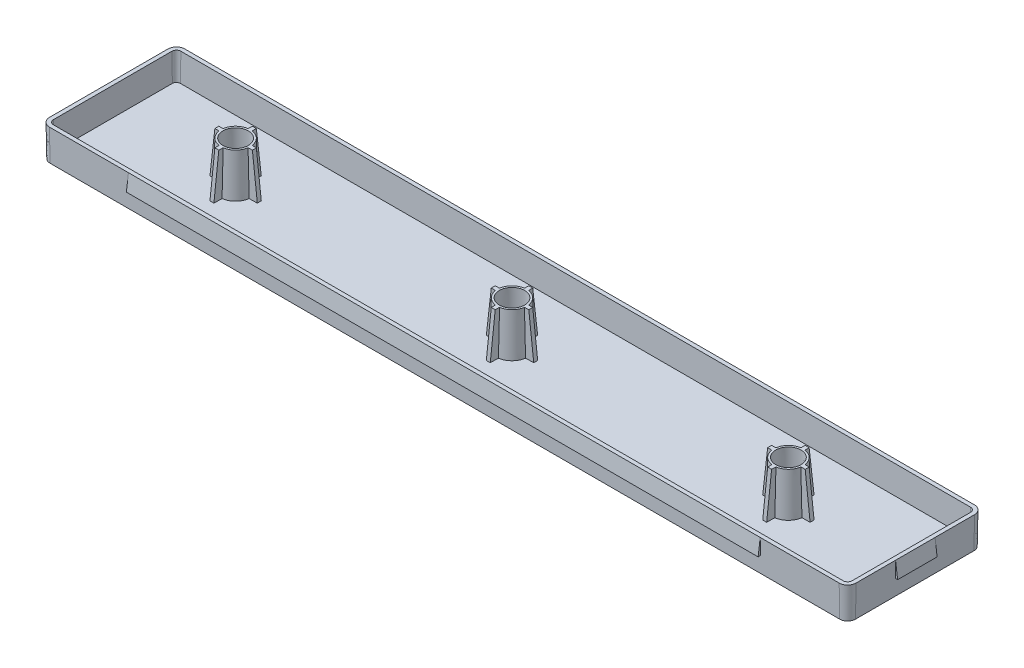
from build123d import *

# Parameters (mm, degrees)
BOSS_EXTRUDE1_DEPTH           = 4
BOSS_EXTRUDE1_DRAFT           = -1
SHELL1_T                      = -0.5
SKETCH2_R                     = 2
BOSS_EXTRUDE2_DEPTH           = 5.5
BOSS_EXTRUDE2_DRAFT           = 1.5
BOSS_EXTRUDE2_PROFILE_2_DEPTH = 5.5
BOSS_EXTRUDE2_PROFILE_2_DRAFT = 1.5
BOSS_EXTRUDE2_PROFILE_3_DEPTH = 5.5
BOSS_EXTRUDE2_PROFILE_3_DRAFT = 1.5
CIRPATTERN1_COUNT             = 4
SKETCH6_R                     = 1.605977431
CUT_EXTRUDE1_DEPTH            = 5.5
CUT_EXTRUDE1_DRAFT            = 1.5
CUT_EXTRUDE1_PROFILE_2_DEPTH  = 5.5
CUT_EXTRUDE1_PROFILE_2_DRAFT  = 1.5
CUT_EXTRUDE1_PROFILE_3_DEPTH  = 5.5
CUT_EXTRUDE1_PROFILE_3_DRAFT  = 1.5
BOSS_EXTRUDE3_DEPTH           = 2.5
BOSS_EXTRUDE4_DEPTH           = 40


with BuildPart() as part:
    # Sketch1 → Boss-Extrude1 (with draft: the straight prism first)
    with BuildSketch(Plane(origin=(0, 0, 0), x_dir=(1, 0, 0), z_dir=(0, 1, 0))):
        with BuildLine():
            Line((-50, -8.5), (50, -8.5))
            ThreePointArc((50, -8.5), (50.707106781, -8.207106781), (51, -7.5))
            Line((51, -7.5), (51, 7.5))
            ThreePointArc((51, 7.5), (50.707106781, 8.207106781), (50, 8.5))
            Line((50, 8.5), (-50, 8.5))
            ThreePointArc((-50, 8.5), (-50.707106781, 8.207106781), (-51, 7.5))
            Line((-51, 7.5), (-51, -7.5))
            ThreePointArc((-51, -7.5), (-50.707106781, -8.207106781), (-50, -8.5))
        make_face()
    extrude(amount=BOSS_EXTRUDE1_DEPTH)
    # Boss-Extrude1: the draft: its side faces are tilted about the plane it starts from
    boss_extrude1_sides = [part.faces().sort_by_distance(p)[0] for p in [
        (0, 2, 8.5),
        (50.707106781, 2, 8.207106781),
        (51, 2, 0),
        (50.707106781, 2, -8.207106781),
        (0, 2, -8.5),
        (-50.707106781, 2, -8.207106781),
        (-51, 2, 0),
        (-50.707106781, 2, 8.207106781),
    ]]
    draft(boss_extrude1_sides, Plane(origin=(0, 0, 0), x_dir=(1, 0, 0), z_dir=(0, 1, 0)), BOSS_EXTRUDE1_DRAFT)

    # Shell1
    shell1_openings = [part.faces().sort_by_distance(p)[0] for p in [
        (0, 4, 0),
    ]]
    offset(amount=SHELL1_T, openings=shell1_openings, kind=Kind.INTERSECTION)


with BuildPart() as boss_extrude2_tool:
    # Sketch2 → Boss-Extrude2 (with draft: the straight prism first)
    with BuildSketch(Plane(origin=(0, 0.5, 0), x_dir=(1, 0, 0), z_dir=(0, 1, 0))):
        with Locations((35, 0)):
            Circle(SKETCH2_R)
    extrude(amount=BOSS_EXTRUDE2_DEPTH)
    # Boss-Extrude2: the draft: its side faces are tilted about the plane it starts from
    boss_extrude2_sides = [boss_extrude2_tool.faces().sort_by_distance(p)[0] for p in [
        (33, 3.25, 0),
    ]]
    draft(boss_extrude2_sides, Plane(origin=(0, 0.5, 0), x_dir=(1, 0, 0), z_dir=(0, 1, 0)), BOSS_EXTRUDE2_DRAFT)


with BuildPart() as part_1:
    add(part.part)

    # Boss-Extrude2: add boss_extrude2_tool
    add(boss_extrude2_tool.part)


with BuildPart() as boss_extrude2_profile_2_tool:
    # Sketch2 → Boss-Extrude2 profile 2 (with draft: the straight prism first)
    with BuildSketch(Plane(origin=(0, 0.5, 0), x_dir=(1, 0, 0), z_dir=(0, 1, 0))):
        Circle(SKETCH2_R)
    extrude(amount=BOSS_EXTRUDE2_PROFILE_2_DEPTH)
    # Boss-Extrude2 profile 2: the draft: its side faces are tilted about the plane it starts from
    boss_extrude2_profile_2_sides = [boss_extrude2_profile_2_tool.faces().sort_by_distance(p)[0] for p in [
        (-2, 3.25, 0),
    ]]
    draft(boss_extrude2_profile_2_sides, Plane(origin=(0, 0.5, 0), x_dir=(1, 0, 0), z_dir=(0, 1, 0)), BOSS_EXTRUDE2_PROFILE_2_DRAFT)


with BuildPart() as part_2:
    add(part_1.part)

    # Boss-Extrude2 profile 2: add boss_extrude2_profile_2_tool
    add(boss_extrude2_profile_2_tool.part)


with BuildPart() as boss_extrude2_profile_3_tool:
    # Sketch2 → Boss-Extrude2 profile 3 (with draft: the straight prism first)
    with BuildSketch(Plane(origin=(0, 0.5, 0), x_dir=(1, 0, 0), z_dir=(0, 1, 0))):
        with Locations((-35, 0)):
            Circle(SKETCH2_R)
    extrude(amount=BOSS_EXTRUDE2_PROFILE_3_DEPTH)
    # Boss-Extrude2 profile 3: the draft: its side faces are tilted about the plane it starts from
    boss_extrude2_profile_3_sides = [boss_extrude2_profile_3_tool.faces().sort_by_distance(p)[0] for p in [
        (-37, 3.25, 0),
    ]]
    draft(boss_extrude2_profile_3_sides, Plane(origin=(0, 0.5, 0), x_dir=(1, 0, 0), z_dir=(0, 1, 0)), BOSS_EXTRUDE2_PROFILE_3_DRAFT)


with BuildPart() as part_3:
    add(part_2.part)

    # Boss-Extrude2 profile 3: add boss_extrude2_profile_3_tool
    add(boss_extrude2_profile_3_tool.part)

    # Rib1: read off the stored shape, not the designer's step
    # Rib1: loft between two sections, ruled curve by curve
    rib1_from = [
        Edge.make_line((-1.837769145, 6, 0.259339154), (-2.376238774, 6, 0.25)),
        Edge.make_line((-2.376238774, 6, -0.25), (-1.837769145, 6, -0.259339154)),
        Edge.make_line((-2.376238774, 6, -0.25), (-2.376238774, 6, 0.25)),
        Edge.make_line((-1.837769145, 6, -0.259339154), (-1.837769145, 6, 0.259339154)),
    ]
    rib1_to = [
        Edge.make_line((-1.98200916, 0.5, 0.267655913), (-3, 0.5, 0.25)),
        Edge.make_line((-3, 0.5, -0.25), (-1.98200916, 0.5, -0.267655913)),
        Edge.make_line((-3, 0.5, -0.25), (-3, 0.5, 0.25)),
        Edge.make_line((-1.98200916, 0.5, -0.267655913), (-1.98200916, 0.5, 0.267655913)),
    ]
    rib1 = Solid(Shell([*[Face.make_surface_from_curves(rib1_from[k], rib1_to[k]) for k in range(4)], Face(Wire(rib1_from)), Face(Wire(rib1_to))]))
    add(rib1)

    # CirPattern1: Rib1 ×4 about axis
    cirpattern1_axis = Axis((0, 0, 0), (0, 1, 0))
    for i in range(1, CIRPATTERN1_COUNT):
        add(rib1.rotate(cirpattern1_axis, i * 360 / CIRPATTERN1_COUNT))

    # LPattern3: read off the stored shape, not the designer's step
    # LPattern3: loft between two sections, ruled curve by curve
    lpattern3_from = [
        Edge.make_line((34.75, 6, 2.376238774), (35.25, 6, 2.376238774)),
        Edge.make_line((35.259339154, 6, 1.837769145), (35.25, 6, 2.376238774)),
        Edge.make_line((34.75, 6, 2.376238774), (34.740660846, 6, 1.837769145)),
        Edge.make_line((34.740660846, 6, 1.837769145), (35.259339154, 6, 1.837769145)),
    ]
    lpattern3_to = [
        Edge.make_line((34.75, 0.5, 3), (35.25, 0.5, 3)),
        Edge.make_line((35.267655913, 0.5, 1.98200916), (35.25, 0.5, 3)),
        Edge.make_line((34.75, 0.5, 3), (34.732344087, 0.5, 1.98200916)),
        Edge.make_line((34.732344087, 0.5, 1.98200916), (35.267655913, 0.5, 1.98200916)),
    ]
    lpattern3 = Solid(Shell([*[Face.make_surface_from_curves(lpattern3_from[k], lpattern3_to[k]) for k in range(4)], Face(Wire(lpattern3_from)), Face(Wire(lpattern3_to))]))
    add(lpattern3)

    # LPattern3 2: loft between two sections, ruled curve by curve
    lpattern3_2_from = [
        Edge.make_line((35.25, 6, -2.376238774), (34.75, 6, -2.376238774)),
        Edge.make_line((34.740660846, 6, -1.837769145), (34.75, 6, -2.376238774)),
        Edge.make_line((35.25, 6, -2.376238774), (35.259339154, 6, -1.837769145)),
        Edge.make_line((35.259339154, 6, -1.837769145), (34.740660846, 6, -1.837769145)),
    ]
    lpattern3_2_to = [
        Edge.make_line((35.25, 0.5, -3), (34.75, 0.5, -3)),
        Edge.make_line((34.732344087, 0.5, -1.98200916), (34.75, 0.5, -3)),
        Edge.make_line((35.25, 0.5, -3), (35.267655913, 0.5, -1.98200916)),
        Edge.make_line((35.267655913, 0.5, -1.98200916), (34.732344087, 0.5, -1.98200916)),
    ]
    lpattern3_2 = Solid(Shell([*[Face.make_surface_from_curves(lpattern3_2_from[k], lpattern3_2_to[k]) for k in range(4)], Face(Wire(lpattern3_2_from)), Face(Wire(lpattern3_2_to))]))
    add(lpattern3_2)

    # LPattern3 3: loft between two sections, ruled curve by curve
    lpattern3_3_from = [
        Edge.make_line((33.162230855, 6, 0.259339154), (32.623761226, 6, 0.25)),
        Edge.make_line((32.623761226, 6, -0.25), (33.162230855, 6, -0.259339154)),
        Edge.make_line((32.623761226, 6, -0.25), (32.623761226, 6, 0.25)),
        Edge.make_line((33.162230855, 6, -0.259339154), (33.162230855, 6, 0.259339154)),
    ]
    lpattern3_3_to = [
        Edge.make_line((33.01799084, 0.5, 0.267655913), (32, 0.5, 0.25)),
        Edge.make_line((32, 0.5, -0.25), (33.01799084, 0.5, -0.267655913)),
        Edge.make_line((32, 0.5, -0.25), (32, 0.5, 0.25)),
        Edge.make_line((33.01799084, 0.5, -0.267655913), (33.01799084, 0.5, 0.267655913)),
    ]
    lpattern3_3 = Solid(Shell([*[Face.make_surface_from_curves(lpattern3_3_from[k], lpattern3_3_to[k]) for k in range(4)], Face(Wire(lpattern3_3_from)), Face(Wire(lpattern3_3_to))]))
    add(lpattern3_3)

    # LPattern3 4: loft between two sections, ruled curve by curve
    lpattern3_4_from = [
        Edge.make_line((36.837769145, 6, -0.259339154), (37.376238774, 6, -0.25)),
        Edge.make_line((37.376238774, 6, 0.25), (36.837769145, 6, 0.259339154)),
        Edge.make_line((37.376238774, 6, 0.25), (37.376238774, 6, -0.25)),
        Edge.make_line((36.837769145, 6, 0.259339154), (36.837769145, 6, -0.259339154)),
    ]
    lpattern3_4_to = [
        Edge.make_line((36.98200916, 0.5, -0.267655913), (38, 0.5, -0.25)),
        Edge.make_line((38, 0.5, 0.25), (36.98200916, 0.5, 0.267655913)),
        Edge.make_line((38, 0.5, 0.25), (38, 0.5, -0.25)),
        Edge.make_line((36.98200916, 0.5, 0.267655913), (36.98200916, 0.5, -0.267655913)),
    ]
    lpattern3_4 = Solid(Shell([*[Face.make_surface_from_curves(lpattern3_4_from[k], lpattern3_4_to[k]) for k in range(4)], Face(Wire(lpattern3_4_from)), Face(Wire(lpattern3_4_to))]))
    add(lpattern3_4)

    # LPattern5: read off the stored shape, not the designer's step
    # LPattern5: loft between two sections, ruled curve by curve
    lpattern5_from = [
        Edge.make_line((-35.25, 6, 2.376238774), (-34.75, 6, 2.376238774)),
        Edge.make_line((-34.740660846, 6, 1.837769145), (-34.75, 6, 2.376238774)),
        Edge.make_line((-35.25, 6, 2.376238774), (-35.259339154, 6, 1.837769145)),
        Edge.make_line((-35.259339154, 6, 1.837769145), (-34.740660846, 6, 1.837769145)),
    ]
    lpattern5_to = [
        Edge.make_line((-35.25, 0.5, 3), (-34.75, 0.5, 3)),
        Edge.make_line((-34.732344087, 0.5, 1.98200916), (-34.75, 0.5, 3)),
        Edge.make_line((-35.25, 0.5, 3), (-35.267655913, 0.5, 1.98200916)),
        Edge.make_line((-35.267655913, 0.5, 1.98200916), (-34.732344087, 0.5, 1.98200916)),
    ]
    lpattern5 = Solid(Shell([*[Face.make_surface_from_curves(lpattern5_from[k], lpattern5_to[k]) for k in range(4)], Face(Wire(lpattern5_from)), Face(Wire(lpattern5_to))]))
    add(lpattern5)

    # LPattern5 2: loft between two sections, ruled curve by curve
    lpattern5_2_from = [
        Edge.make_line((-34.75, 6, -2.376238774), (-35.25, 6, -2.376238774)),
        Edge.make_line((-35.259339154, 6, -1.837769145), (-35.25, 6, -2.376238774)),
        Edge.make_line((-34.75, 6, -2.376238774), (-34.740660846, 6, -1.837769145)),
        Edge.make_line((-34.740660846, 6, -1.837769145), (-35.259339154, 6, -1.837769145)),
    ]
    lpattern5_2_to = [
        Edge.make_line((-34.75, 0.5, -3), (-35.25, 0.5, -3)),
        Edge.make_line((-35.267655913, 0.5, -1.98200916), (-35.25, 0.5, -3)),
        Edge.make_line((-34.75, 0.5, -3), (-34.732344087, 0.5, -1.98200916)),
        Edge.make_line((-34.732344087, 0.5, -1.98200916), (-35.267655913, 0.5, -1.98200916)),
    ]
    lpattern5_2 = Solid(Shell([*[Face.make_surface_from_curves(lpattern5_2_from[k], lpattern5_2_to[k]) for k in range(4)], Face(Wire(lpattern5_2_from)), Face(Wire(lpattern5_2_to))]))
    add(lpattern5_2)

    # LPattern5 3: loft between two sections, ruled curve by curve
    lpattern5_3_from = [
        Edge.make_line((-36.837769145, 6, 0.259339154), (-37.376238774, 6, 0.25)),
        Edge.make_line((-37.376238774, 6, -0.25), (-36.837769145, 6, -0.259339154)),
        Edge.make_line((-37.376238774, 6, -0.25), (-37.376238774, 6, 0.25)),
        Edge.make_line((-36.837769145, 6, -0.259339154), (-36.837769145, 6, 0.259339154)),
    ]
    lpattern5_3_to = [
        Edge.make_line((-36.98200916, 0.5, 0.267655913), (-38, 0.5, 0.25)),
        Edge.make_line((-38, 0.5, -0.25), (-36.98200916, 0.5, -0.267655913)),
        Edge.make_line((-38, 0.5, -0.25), (-38, 0.5, 0.25)),
        Edge.make_line((-36.98200916, 0.5, -0.267655913), (-36.98200916, 0.5, 0.267655913)),
    ]
    lpattern5_3 = Solid(Shell([*[Face.make_surface_from_curves(lpattern5_3_from[k], lpattern5_3_to[k]) for k in range(4)], Face(Wire(lpattern5_3_from)), Face(Wire(lpattern5_3_to))]))
    add(lpattern5_3)

    # LPattern5 4: loft between two sections, ruled curve by curve
    lpattern5_4_from = [
        Edge.make_line((-33.162230855, 6, -0.259339154), (-32.623761226, 6, -0.25)),
        Edge.make_line((-32.623761226, 6, 0.25), (-33.162230855, 6, 0.259339154)),
        Edge.make_line((-32.623761226, 6, 0.25), (-32.623761226, 6, -0.25)),
        Edge.make_line((-33.162230855, 6, 0.259339154), (-33.162230855, 6, -0.259339154)),
    ]
    lpattern5_4_to = [
        Edge.make_line((-33.01799084, 0.5, -0.267655913), (-32, 0.5, -0.25)),
        Edge.make_line((-32, 0.5, 0.25), (-33.01799084, 0.5, 0.267655913)),
        Edge.make_line((-32, 0.5, 0.25), (-32, 0.5, -0.25)),
        Edge.make_line((-33.01799084, 0.5, 0.267655913), (-33.01799084, 0.5, -0.267655913)),
    ]
    lpattern5_4 = Solid(Shell([*[Face.make_surface_from_curves(lpattern5_4_from[k], lpattern5_4_to[k]) for k in range(4)], Face(Wire(lpattern5_4_from)), Face(Wire(lpattern5_4_to))]))
    add(lpattern5_4)


with BuildPart() as cut_extrude1_tool:
    # Sketch6 → Cut-Extrude1 (with draft: the straight prism first)
    with BuildSketch(Plane(origin=(0, 6, 0), x_dir=(1, 0, 0), z_dir=(0, 1, 0))):
        with Locations((-35, 0)):
            Circle(SKETCH6_R)
    extrude(amount=-CUT_EXTRUDE1_DEPTH)
    # Cut-Extrude1: the draft: its side faces are tilted about the plane it starts from
    cut_extrude1_sides = [cut_extrude1_tool.faces().sort_by_distance(p)[0] for p in [
        (-36.605977431, 3.25, 0),
    ]]
    draft(cut_extrude1_sides, Plane(origin=(0, 6, 0), x_dir=(1, 0, 0), z_dir=(0, 1, 0)), CUT_EXTRUDE1_DRAFT)


with BuildPart() as part_4:
    add(part_3.part)

    # Cut-Extrude1: cut by cut_extrude1_tool
    add(cut_extrude1_tool.part, mode=Mode.SUBTRACT)


with BuildPart() as cut_extrude1_profile_2_tool:
    # Sketch6 → Cut-Extrude1 profile 2 (with draft: the straight prism first)
    with BuildSketch(Plane(origin=(0, 6, 0), x_dir=(1, 0, 0), z_dir=(0, 1, 0))):
        Circle(SKETCH6_R)
    extrude(amount=-CUT_EXTRUDE1_PROFILE_2_DEPTH)
    # Cut-Extrude1 profile 2: the draft: its side faces are tilted about the plane it starts from
    cut_extrude1_profile_2_sides = [cut_extrude1_profile_2_tool.faces().sort_by_distance(p)[0] for p in [
        (-1.605977431, 3.25, 0),
    ]]
    draft(cut_extrude1_profile_2_sides, Plane(origin=(0, 6, 0), x_dir=(1, 0, 0), z_dir=(0, 1, 0)), CUT_EXTRUDE1_PROFILE_2_DRAFT)


with BuildPart() as part_5:
    add(part_4.part)

    # Cut-Extrude1 profile 2: cut by cut_extrude1_profile_2_tool
    add(cut_extrude1_profile_2_tool.part, mode=Mode.SUBTRACT)


with BuildPart() as cut_extrude1_profile_3_tool:
    # Sketch6 → Cut-Extrude1 profile 3 (with draft: the straight prism first)
    with BuildSketch(Plane(origin=(0, 6, 0), x_dir=(1, 0, 0), z_dir=(0, 1, 0))):
        with Locations((35, 0)):
            Circle(SKETCH6_R)
    extrude(amount=-CUT_EXTRUDE1_PROFILE_3_DEPTH)
    # Cut-Extrude1 profile 3: the draft: its side faces are tilted about the plane it starts from
    cut_extrude1_profile_3_sides = [cut_extrude1_profile_3_tool.faces().sort_by_distance(p)[0] for p in [
        (33.394022569, 3.25, 0),
    ]]
    draft(cut_extrude1_profile_3_sides, Plane(origin=(0, 6, 0), x_dir=(1, 0, 0), z_dir=(0, 1, 0)), CUT_EXTRUDE1_PROFILE_3_DRAFT)


with BuildPart() as part_6:
    add(part_5.part)

    # Cut-Extrude1 profile 3: cut by cut_extrude1_profile_3_tool
    add(cut_extrude1_profile_3_tool.part, mode=Mode.SUBTRACT)

    # Sketch7 → Boss-Extrude3 (add, symmetric)
    with BuildSketch(Plane.XY):
        Polygon((51.06982026, 4), (51.03491013, 2), (51.33491013, 2), align=None)
        Polygon((-51.33491013, 2), (-51.06982026, 4), (-51.03491013, 2), align=None)
    extrude(amount=BOSS_EXTRUDE3_DEPTH, both=True)

    # Sketch8 → Boss-Extrude4 (add, symmetric)
    with BuildSketch(Plane(origin=(0, 0, 0), x_dir=(0, 0, -1), z_dir=(1, 0, 0))):
        Polygon((8.56982026, 4), (8.53491013, 2), (8.83491013, 2), align=None)
        Polygon((-8.83491013, 2), (-8.56982026, 4), (-8.53491013, 2), align=None)
    extrude(amount=BOSS_EXTRUDE4_DEPTH, both=True)


solid = part_6.part
